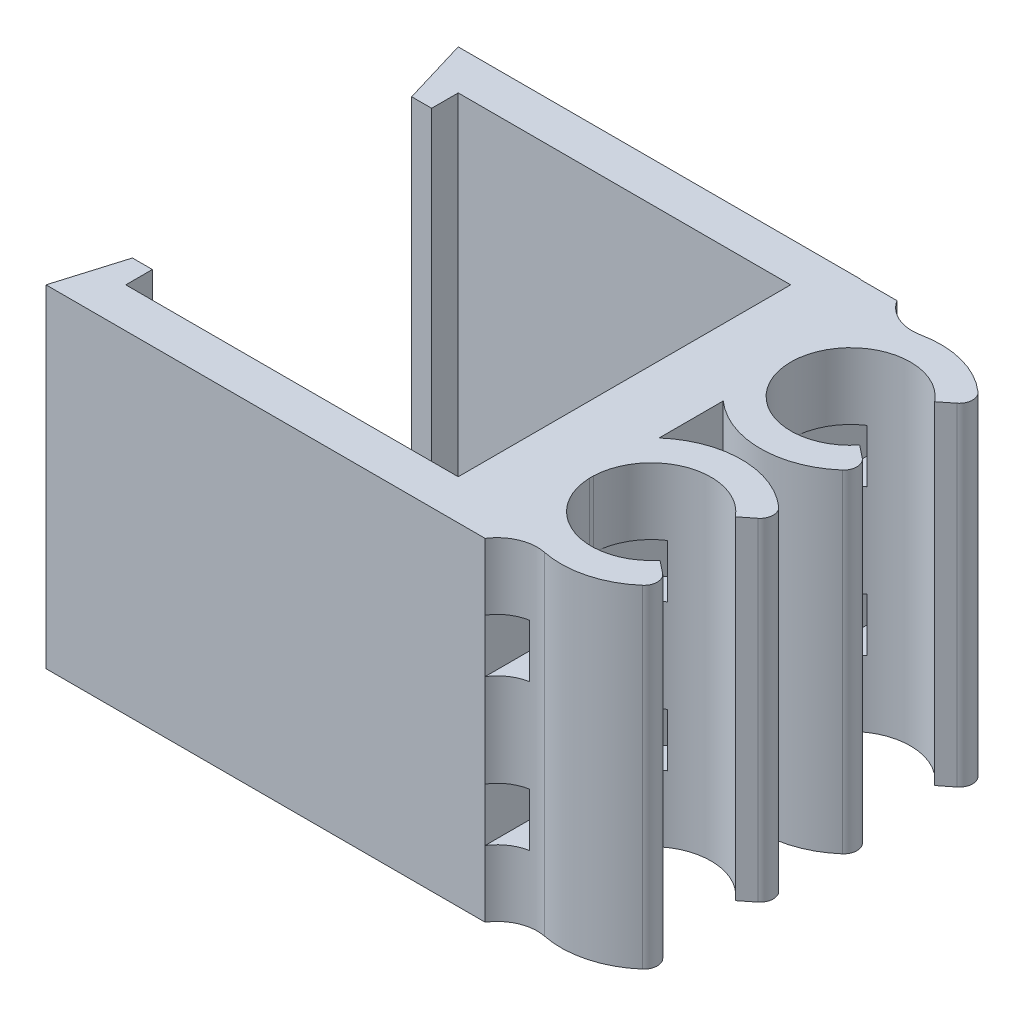
from build123d import *

# Parameters (mm, degrees)
EXTRUDE_1_DEPTH      = 25
CUT_EXTRUDE_4_DEPTH  = 80.457942189
SKETCH_7_W           = 16.60831278
SKETCH_7_H           = 38.473598513
CUT_EXTRUDE_14_DEPTH = 80.457942189
SKETCH_8_W           = 5
SKETCH_8_H           = 30.968526609
EXTRUDE_2_DEPTH      = 25
EXTRUDE_3_DEPTH      = 25
FILLET_2_R           = 3
FILLET_4_R           = 1
SKETCH_10_W          = 2
SKETCH_10_H          = 4
CUT_EXTRUDE_15_DEPTH = 78.792556685


with BuildPart() as part:
    # Эскиз1 → Бобышка-Вытянуть1 (new body)
    with BuildSketch(Plane(origin=(0, 0, 0), x_dir=(1, 0, 0), z_dir=(0, 1, 0))):
        Polygon((-66.825757576, 34.969739794), (-66.825757576, 29.969739794), (-63.825757576, 29.969739794), (-63.825757576, 31.969739794), (-38.825757576, 31.969739794), (-38.825757576, 6.969739794), (-63.825757576, 6.969739794), (-63.825757576, 8.969739794), (-66.825757576, 8.969739794), (-66.825757576, 3.969739794), (-22.123470102, 3.969739794), (-36.579007505, 34.969739794), align=None)
    extrude(amount=EXTRUDE_1_DEPTH)

    # Эскиз3 → Вырез-Вытянуть4 (cut, through all)
    with BuildSketch(Plane.XZ):
        Polygon((-66.825757576, -3.969739794), (-65.325757576, -8.969739794), (-66.825757576, -8.969739794), align=None)
        Polygon((-66.825757576, -29.969739794), (-66.825757576, -34.969739794), (-65.325757576, -29.969739794), align=None)
    extrude(amount=-CUT_EXTRUDE_4_DEPTH, mode=Mode.SUBTRACT)

    # Эскиз7 → Вырез-Вытянуть14 (cut, through all)
    with BuildSketch(Plane(origin=(0, 0, 0), x_dir=(-1, 0, 0), z_dir=(0, -1, 0))):
        with Locations((27.703474463, 20.539743139)):
            Rectangle(SKETCH_7_W, SKETCH_7_H)
    extrude(amount=-CUT_EXTRUDE_14_DEPTH, mode=Mode.SUBTRACT)

    # Эскиз8 → Бобышка-Вытянуть2 (add)
    with BuildSketch(Plane(origin=(0, 0, 0), x_dir=(-1, 0, 0), z_dir=(0, -1, 0))):
        with Locations((36.298943925, 19.454003098)):
            Rectangle(SKETCH_8_W, SKETCH_8_H)
    extrude(amount=-EXTRUDE_2_DEPTH)

    # Эскиз9 → Бобышка-Вытянуть3 (add)
    with BuildSketch(Plane.XZ):
        with BuildLine():
            Line((-25.798943925, -9.121669553), (-24.000865345, -7.695483003))
            ThreePointArc((-24.000865345, -7.695483003), (-36.096342696, -11.954003099), (-24.000865345, -16.212523195))
            Line((-24.000865345, -16.212523195), (-25.798943925, -14.786336644))
            ThreePointArc((-25.798943925, -14.786336644), (-33.80140029, -11.954003099), (-25.798943925, -9.121669553))
        make_face()
        with BuildLine():
            Line((-25.798943925, -24.130682885), (-24.000865345, -22.7126007))
            ThreePointArc((-24.000865345, -22.7126007), (-36.0856317, -26.954003099), (-24.000865345, -31.195405497))
            Line((-24.000865345, -31.195405497), (-25.798943925, -29.777323313))
            ThreePointArc((-25.798943925, -29.777323313), (-33.795735785, -26.954003099), (-25.798943925, -24.130682885))
        make_face()
    extrude(amount=-EXTRUDE_3_DEPTH)

    # Скругление2
    # the kernel refuses this fillet: 3 mm, written as the material it adds along each edge
    with BuildSketch(Plane(origin=(-33.798943925, 25, -6.859434417), x_dir=(0, 0, 1), z_dir=(0, -1, 0))) as fillet_2_piece_1:
        with BuildLine():
            CenterArc((4.502629254, -2.529514158), FILLET_2_R, 122.523458888, 69.079199353)
            Line((1.563931496, -3.132884263), (1.505157541, -3.144951665))
            ThreePointArc((1.505157541, -3.144951665), (0.933475042, -1.490808901), (-0.044969279, -0.039721077))
            Line((-0.044969279, -0.039721077), (0, 0.06))
            ThreePointArc((0, 0.06), (1.444847312, 0.06), (2.85743593, 0.050590283))
            Line((2.85743593, 0.050590283), (2.889694623, 0))
        make_face()
    extrude(amount=25)
    with BuildSketch(Plane(origin=(-33.798943925, 25, -32.034271886), x_dir=(0, 0, -1), z_dir=(0, -1, 0))) as fillet_2_piece_2:
        with BuildLine():
            CenterArc((4.507255062, 2.535656843), FILLET_2_R, 168.421178081, 69.274223823)
            Line((1.568306542, 3.137804332), (1.509527572, 3.149847282))
            ThreePointArc((1.509527572, 3.149847282), (0.936720457, 1.492647534), (-0.044913828, 0.039783766))
            Line((-0.044913828, 0.039783766), (0, -0.06))
            ThreePointArc((0, -0.06), (1.451997259, -0.06), (2.871929307, -0.050713137))
            Line((2.871929307, -0.050713137), (2.903994517, 0))
        make_face()
    extrude(amount=25)

    # Скругление4
    fillet_4_edges = [part.edges().sort_by_distance(p)[0] for p in [
        (-24.000865345, 12.5, -7.695483003),
        (-24.000865345, 12.5, -16.212523195),
        (-24.000865345, 12.5, -22.7126007),
        (-24.000865345, 12.5, -31.195405497),
    ]]
    fillet(fillet_4_edges, radius=FILLET_4_R)

    # Эскиз10 → Вырез-Вытянуть15 (cut, through all)
    with BuildSketch(Plane.XY.offset(-3.969739794)):
        with Locations((-32.798943925, 18)):
            Rectangle(SKETCH_10_W, SKETCH_10_H)
        with Locations((-32.798943925, 7)):
            Rectangle(SKETCH_10_W, SKETCH_10_H)
    extrude(amount=-CUT_EXTRUDE_15_DEPTH, mode=Mode.SUBTRACT)


solid = part.part
